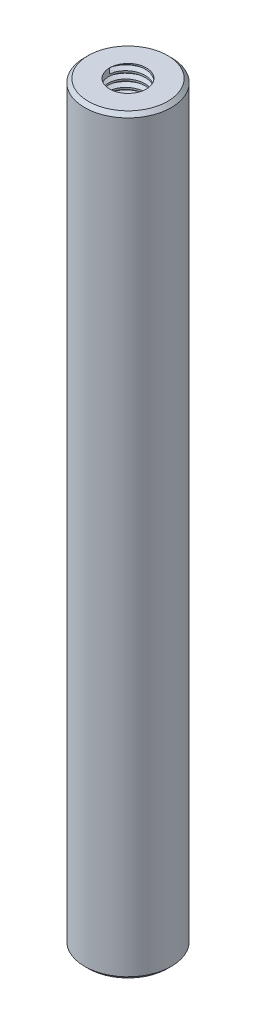
from build123d import *
from build123d.topology import SkipClean

# Parameters (mm, degrees)
CROQUIS2_R              = 4.7625
SALIENTE_EXTRUIR1_DEPTH = 41.275
CHAFL_N1_SIZE           = 0.396875
TAP_START               = 41.275
CROQUIS3_R              = 2.0193
TAP_HOLE_1_DEPTH        = 19.05
TAP_START_2             = -22.225
CROQUIS3_2_R            = 2.0193
TAP_HOLE_2_DEPTH        = 19.05
ROSCA1_PITCH            = 0.79375
ROSCA2_PITCH            = 0.79375


with BuildPart() as part:
    # Croquis2 → Saliente-Extruir1 (new, symmetric)
    with BuildSketch(Plane(origin=(0, 0, 0), x_dir=(1, 0, 0), z_dir=(0, 1, 0))):
        with Locations(Location((0, 0, 0), (0, 0, 270))):
            Circle(CROQUIS2_R)
    extrude(amount=SALIENTE_EXTRUIR1_DEPTH, both=True)

    # Chaflán1
    chafl_n1_edges = [part.edges().sort_by_distance(p)[0] for p in [
        (0, -41.275, -4.7625),
        (0, 41.275, -4.7625),
    ]]
    chamfer(chafl_n1_edges, length=CHAFL_N1_SIZE)

    # Croquis3 → Tap Hole 1 (cut)
    with BuildSketch(Plane(origin=(0, 0, 0), x_dir=(1, 0, 0), z_dir=(0, 1, 0)).offset(TAP_START)):
        with Locations(Location((0, 0, 0), (0, 0, 270))):
            Circle(CROQUIS3_R)
    extrude(amount=-TAP_HOLE_1_DEPTH, mode=Mode.SUBTRACT)

    # Croquis3<2> → Tap Hole 2 (cut)
    with BuildSketch(Plane(origin=(0, 0, 0), x_dir=(1, 0, 0), z_dir=(0, 1, 0)).offset(TAP_START_2)):
        with Locations(Location((0, 0, 0), (0, 0, 270))):
            Circle(CROQUIS3_2_R)
    extrude(amount=-TAP_HOLE_2_DEPTH, mode=Mode.SUBTRACT)

    # Rosca1: arcs per turn and ends read off the stored shape
    # Rosca1: the profile of Perfil de rosca1 profile screwed along a right-hand helix through 24 turns, 8 arcs to a turn; built about Z, then put on its axis
    with SkipClean():  # the faces are left unmerged after this step: merging them gives an invalid solid
        rosca1_z = Axis((0, 0, 0), (0, 0, 1))
        rosca1_corners = [(2.019, 0, -0.000173205), (2.448929788, 0, 0.248046874), (2.448929788, 0, 0.347265624), (2.019, 0, 0.595485703)]
        with BuildLine(mode=Mode.PRIVATE) as rosca1_profile:
            Line(rosca1_corners[0], rosca1_corners[1])
            Line(rosca1_corners[1], rosca1_corners[2])
            Line(rosca1_corners[2], rosca1_corners[3])
            Line(rosca1_corners[3], rosca1_corners[0])
        rosca1_cap = Face(rosca1_profile.wire())
        rosca1_turn_angles = [0, 22.5, 45, 67.5, 90, 112.5, 135, 157.5, 180, 202.5, 225, 247.5, 270, 292.5, 315, 337.5, 360]
        rosca1_turn_weights = [1, 0.9238795325112867, 1, 0.9238795325112867, 1, 0.9238795325112867, 1, 0.9238795325112867, 1, 0.9238795325112867, 1, 0.9238795325112867, 1, 0.9238795325112867, 1, 0.9238795325112867, 1]
        rosca1_turn_rails = [Edge.make_bspline([Vector(p[0], p[1], 0).rotate(rosca1_z, rosca1_turn_angles[k]) / rosca1_turn_weights[k] + Vector(0, 0, p[2] + ROSCA1_PITCH * rosca1_turn_angles[k] / 360) for k in range(17)], [0, 0, 0, 1, 1, 2, 2, 3, 3, 4, 4, 5, 5, 6, 6, 7, 7, 8, 8, 8], 2, rosca1_turn_weights) for p in rosca1_corners]
        rosca1_turn_sides = [Face.make_surface_from_curves(rosca1_turn_rails[p[0]], rosca1_turn_rails[p[1]]) for p in [(0, 1), (1, 2), (2, 3), (3, 0)]]
        rosca1 = Plane(origin=(0, 41.275, 0), x_dir=(-1, 0, 0), z_dir=(0, -1, 0)) * Solid(Shell([*[p.moved(Location((0, 0, ROSCA1_PITCH * i))) for i in range(24) for p in rosca1_turn_sides], rosca1_cap, rosca1_cap.rotate(rosca1_z, 8640).moved(Location((0, 0, ROSCA1_PITCH * 8640 / 360)))]))
        add(rosca1, mode=Mode.SUBTRACT)

    # Rosca2: arcs per turn and ends read off the stored shape
    # Rosca2: the profile of Perfil de rosca2 profile screwed along a right-hand helix through 24 turns, 8 arcs to a turn; built about Z, then put on its axis
    with SkipClean():  # the faces are left unmerged after this step: merging them gives an invalid solid
        rosca2_z = Axis((0, 0, 0), (0, 0, 1))
        rosca2_corners = [(2.019, 0, -0.000173205), (2.448929788, 0, 0.248046874), (2.448929788, 0, 0.347265624), (2.019, 0, 0.595485703)]
        with BuildLine(mode=Mode.PRIVATE) as rosca2_profile:
            Line(rosca2_corners[0], rosca2_corners[1])
            Line(rosca2_corners[1], rosca2_corners[2])
            Line(rosca2_corners[2], rosca2_corners[3])
            Line(rosca2_corners[3], rosca2_corners[0])
        rosca2_cap = Face(rosca2_profile.wire())
        rosca2_turn_angles = [0, 22.5, 45, 67.5, 90, 112.5, 135, 157.5, 180, 202.5, 225, 247.5, 270, 292.5, 315, 337.5, 360]
        rosca2_turn_weights = [1, 0.9238795325112867, 1, 0.9238795325112867, 1, 0.9238795325112867, 1, 0.9238795325112867, 1, 0.9238795325112867, 1, 0.9238795325112867, 1, 0.9238795325112867, 1, 0.9238795325112867, 1]
        rosca2_turn_rails = [Edge.make_bspline([Vector(p[0], p[1], 0).rotate(rosca2_z, rosca2_turn_angles[k]) / rosca2_turn_weights[k] + Vector(0, 0, p[2] + ROSCA2_PITCH * rosca2_turn_angles[k] / 360) for k in range(17)], [0, 0, 0, 1, 1, 2, 2, 3, 3, 4, 4, 5, 5, 6, 6, 7, 7, 8, 8, 8], 2, rosca2_turn_weights) for p in rosca2_corners]
        rosca2_turn_sides = [Face.make_surface_from_curves(rosca2_turn_rails[p[0]], rosca2_turn_rails[p[1]]) for p in [(0, 1), (1, 2), (2, 3), (3, 0)]]
        rosca2 = Plane(origin=(0, -41.275, 0), x_dir=(1, 0, 0), z_dir=(0, 1, 0)) * Solid(Shell([*[p.moved(Location((0, 0, ROSCA2_PITCH * i))) for i in range(24) for p in rosca2_turn_sides], rosca2_cap, rosca2_cap.rotate(rosca2_z, 8640).moved(Location((0, 0, ROSCA2_PITCH * 8640 / 360)))]))
        add(rosca2, mode=Mode.SUBTRACT)


solid = part.part
